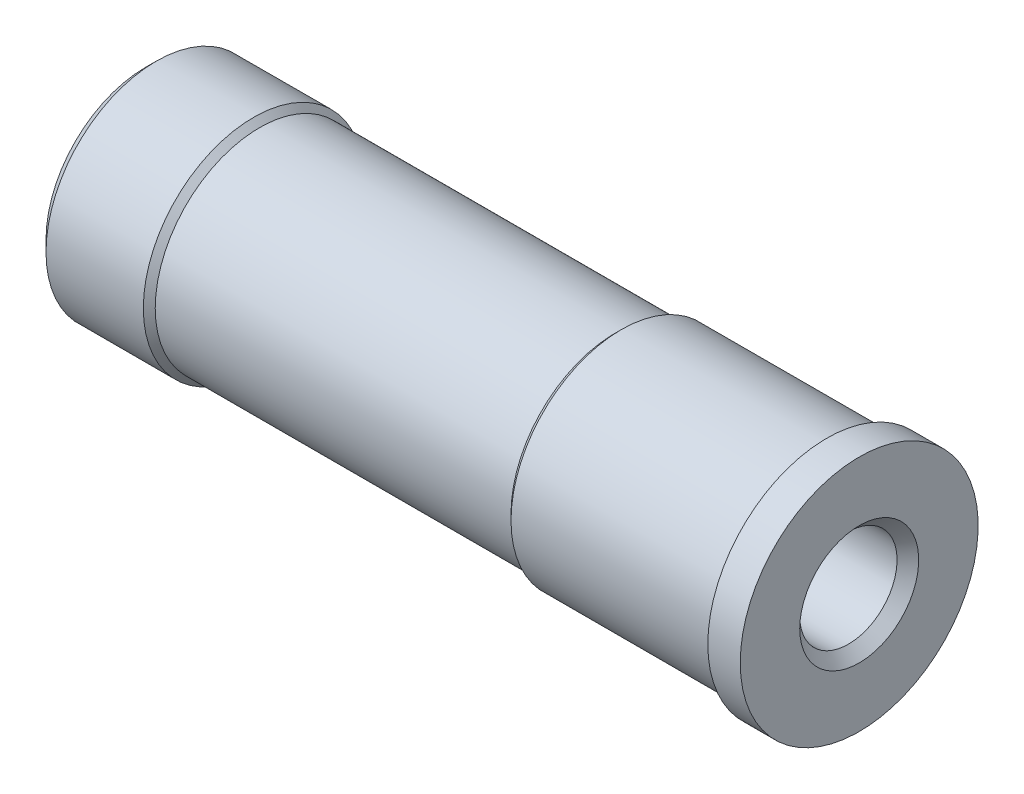
from build123d import *

# Parameters (mm, degrees)
SFAZOWANIE1_SIZE = 1
SFAZOWANIE2_SIZE = 1
SFAZOWANIE3_SIZE = 1


with BuildPart() as part:
    # Szkic1 → Obrót1 (revolve)
    with BuildSketch(Plane.XY, mode=Mode.PRIVATE) as obr_t1_sk:
        Polygon((0, 4.5), (0, 10.2), (11, 10.2), (11, 9.65), (43, 9.65), (43, 10.2), (63, 10.2), (63, 11), (66, 11), (66, 4.5), (42, 4.5), (42, 0), (19, 0), (19, 4.5), align=None)
    revolve(obr_t1_sk.sketch.rotate(Axis((0, 0, 0), (1, 0, 0)), 90), axis=Axis((0, 0, 0), (1, 0, 0)))

    # Sfazowanie1
    sfazowanie1_edges = [part.edges().sort_by_distance(p)[0] for p in [
        (0, 0, -10.2),
    ]]
    chamfer(sfazowanie1_edges, length=SFAZOWANIE1_SIZE)

    # Sfazowanie2
    # the kernel refuses this chamfer: 1 mm, written as the material it takes off along each edge
    with BuildSketch(Plane(origin=(11, 0, 0), x_dir=(0, 0, 1), z_dir=(0, 1, 0))) as sfazowanie2_piece_1_section:
        Polygon((10.2, -SFAZOWANIE2_SIZE), (10.2 - SFAZOWANIE2_SIZE, 0), (10.2, 0), align=None)
    sfazowanie2_piece_1 = revolve(axis=Axis((11, 0, 0), (1, 0, 0)), mode=Mode.PRIVATE)
    sfazowanie2_piece_1 = sfazowanie2_piece_1 - Plane(origin=(10.282118865, 0, 0), x_dir=(0, 0, 1), z_dir=(1, 0, 0)) * Cylinder(9.65, 41, mode=Mode.PRIVATE)
    add(sfazowanie2_piece_1, mode=Mode.SUBTRACT)
    with BuildSketch(Plane(origin=(43, 0, 0), x_dir=(0, 0, 1), z_dir=(0, 1, 0))) as sfazowanie2_piece_2_section:
        Polygon((10.2 - SFAZOWANIE2_SIZE, 0), (10.2, SFAZOWANIE2_SIZE), (10.2, 0), align=None)
    sfazowanie2_piece_2 = revolve(axis=Axis((43, 0, 0), (1, 0, 0)), mode=Mode.PRIVATE)
    sfazowanie2_piece_2 = sfazowanie2_piece_2 - Plane(origin=(43.717881135, 0, 0), x_dir=(0, 0, 1), z_dir=(1, 0, 0)) * Cylinder(9.65, 41, mode=Mode.PRIVATE)
    add(sfazowanie2_piece_2, mode=Mode.SUBTRACT)

    # Sfazowanie3
    sfazowanie3_edges = [part.edges().sort_by_distance(p)[0] for p in [
        (0, 0, -4.5),
        (66, 0, -4.5),
    ]]
    chamfer(sfazowanie3_edges, length=SFAZOWANIE3_SIZE)


solid = part.part
